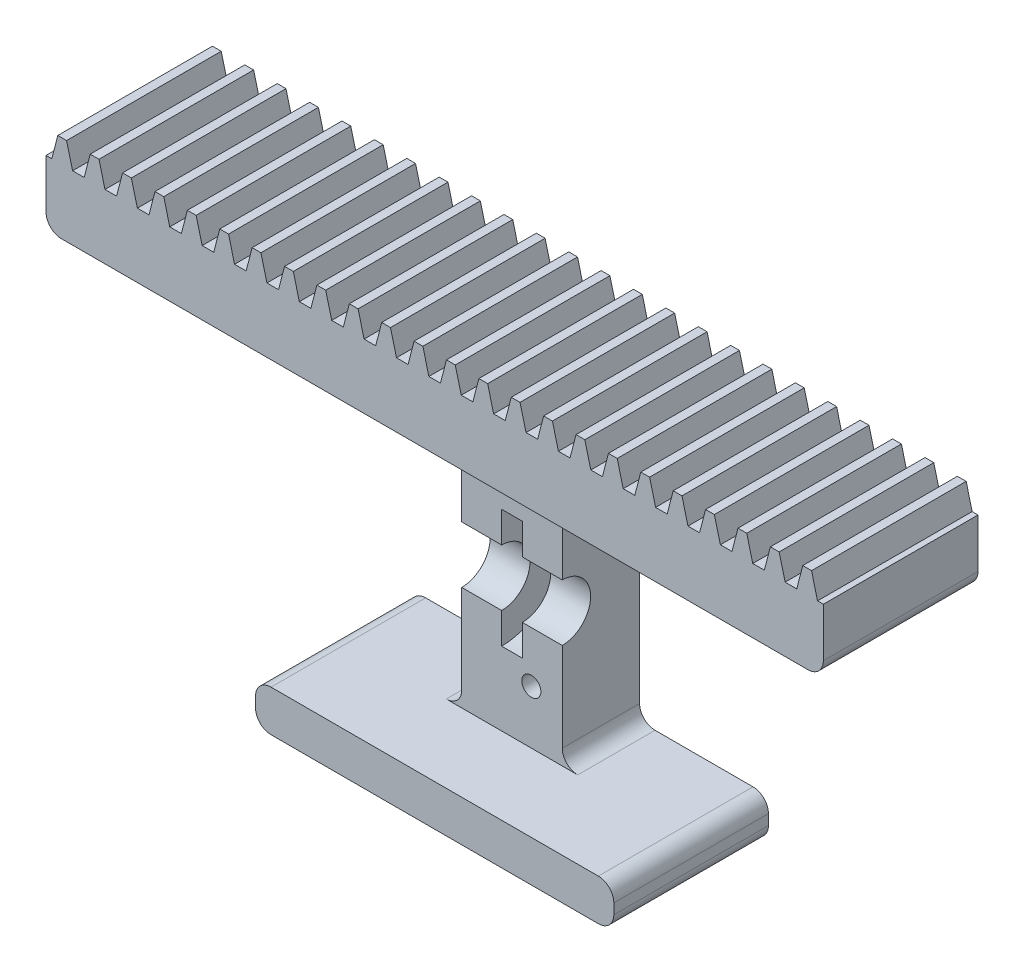
from build123d import *

# Parameters (mm, degrees)
BLANKSKE_W                            = 150.8
BLANKSKE_H                            = 17
BLANK_CREMALHEIRA_DEPTH               = 30
CORTE_DENTE_DIMENSIONADO_DEPTH        = 155.692081245
CORTE_DESTES_COUNT                    = 26
CORTE_DESTES_PITCH                    = 6.2831853
CORPO_DE_APOIO_DEPTH                  = 30
SKETCH2_W                             = 19.5
SKETCH2_H                             = 55
REBAIXO_DEPTH                         = 15
ENCAIXE_FLANGE_11_PASSANTE_DEPTH      = 103.733441488
ENCAIXE_FLANGE_11_PASSANTE_DEPTH_BACK = 103.733441488
SKETCH3_R                             = 5.5
SKETCH3_3_R                           = 11.5
SKETCH3_3_R_2                         = 5.5
ENCAIXE_FLANGE_23X4_DEPTH             = 2
REBAIXOS_DAS_PORCAS_DEPTH             = 4
SKETCH5_R                             = 1.85
FUROS_DE_FIXA_O_DEPTH                 = 166.486071921
RAIOS_3MM_R                           = 3
RAIOS_5MM_R                           = 5


with BuildPart() as part:
    # BlankSke → Blank Cremalheira (new body)
    with BuildSketch(Plane.XY):
        with Locations((75.4, 8.5)):
            Rectangle(BLANKSKE_W, BLANKSKE_H)
    extrude(amount=-BLANK_CREMALHEIRA_DEPTH)

    # TooCutSkeSim → Corte - Dente Dimensionado (cut, through all)
    with BuildSketch(Plane.XY):
        Polygon((1.125252364, 12.5), (-1.125252364, 12.5), (-2.29560038, 17.0254), (2.29560038, 17.0254), align=None)
    corte_dente_dimensionado = extrude(amount=-CORTE_DENTE_DIMENSIONADO_DEPTH, mode=Mode.SUBTRACT)

    # Corte - Destes: Corte - Dente Dimensionado ×26
    with Locations(*[(i * CORTE_DESTES_PITCH, 0, 0) for i in range(1, CORTE_DESTES_COUNT)]):
        add(corte_dente_dimensionado, mode=Mode.SUBTRACT)

    # Sketch1 → Corpo de Apoio (add)
    with BuildSketch(Plane(origin=(0, 0, -30), x_dir=(-1, 0, 0), z_dir=(0, 0, -1))):
        Polygon((-65.65, 0), (-85.15, 0), (-85.15, -55), (-110.15, -55), (-110.15, -63), (-40.65, -63), (-40.65, -55), (-65.65, -55), align=None)
    extrude(amount=-CORPO_DE_APOIO_DEPTH)

    # Sketch2 → Rebaixo (cut)
    with BuildSketch(Plane.XY):
        with Locations((75.4, -27.5)):
            Rectangle(SKETCH2_W, SKETCH2_H)
    extrude(amount=-REBAIXO_DEPTH, mode=Mode.SUBTRACT)

    # Sketch3 → Encaixe Flange - Ø11 Passante (cut, two sides: drawn at the far end of the back side and taken through both)
    with BuildSketch(Plane.ZY.offset(-75.4).offset(-ENCAIXE_FLANGE_11_PASSANTE_DEPTH_BACK)):
        with Locations((-15, -29.25)):
            Circle(SKETCH3_R)
    extrude(amount=ENCAIXE_FLANGE_11_PASSANTE_DEPTH + ENCAIXE_FLANGE_11_PASSANTE_DEPTH_BACK, mode=Mode.SUBTRACT)

    # Sketch3<3> → Encaixe Flange - Ø23x4 (cut, symmetric)
    with BuildSketch(Plane.ZY.offset(-75.4)):
        with Locations((-15, -29.25)):
            Circle(SKETCH3_3_R)
        with Locations((-15, -29.25)):
            Circle(SKETCH3_3_R_2, mode=Mode.SUBTRACT)
    extrude(amount=ENCAIXE_FLANGE_23X4_DEPTH, both=True, mode=Mode.SUBTRACT)

    # Sketch4 → Rebaixos das Porcas (cut)
    with BuildSketch(Plane(origin=(0, 0, -30), x_dir=(-1, 0, 0), z_dir=(0, 0, -1))):
        Polygon((-71.65, -3.843078062), (-75.25, -5.921539031), (-75.25, -10.078460969), (-71.65, -12.156921938), (-68.05, -10.078460969), (-68.05, -5.921539031), align=None)
        Polygon((-79.15, -40.443072948), (-82.75, -42.521533917), (-82.75, -46.678455855), (-79.15, -48.756916824), (-75.55, -46.678455855), (-75.55, -42.521533917), align=None)
    extrude(amount=-REBAIXOS_DAS_PORCAS_DEPTH, mode=Mode.SUBTRACT)

    # Sketch5 → Furos de Fixação (cut, through all)
    with BuildSketch(Plane(origin=(0, 0, -26), x_dir=(-1, 0, 0), z_dir=(0, 0, -1))):
        with Locations((-79.15, -44.599994886)):
            Circle(SKETCH5_R)
        with Locations((-71.65, -8)):
            Circle(SKETCH5_R)
    extrude(amount=-FUROS_DE_FIXA_O_DEPTH, mode=Mode.SUBTRACT)

    # Raios 3mm
    raios_3mm_edges = [part.edges().sort_by_distance(p)[0] for p in [
        (110.15, -63, -15),
        (110.15, -55, -15),
        (40.65, -63, -15),
        (65.65, -55, -22.5),
        (40.65, -55, -15),
        (85.15, -55, -22.5),
        (0, 0, -15),
        (150.8, 0, -15),
    ]]
    fillet(raios_3mm_edges, radius=RAIOS_3MM_R)

    # Raios 5mm
    raios_5mm_edges = [part.edges().sort_by_distance(p)[0] for p in [
        (85.15, 0, -22.5),
        (65.65, 0, -22.5),
    ]]
    fillet(raios_5mm_edges, radius=RAIOS_5MM_R)


solid = part.part
